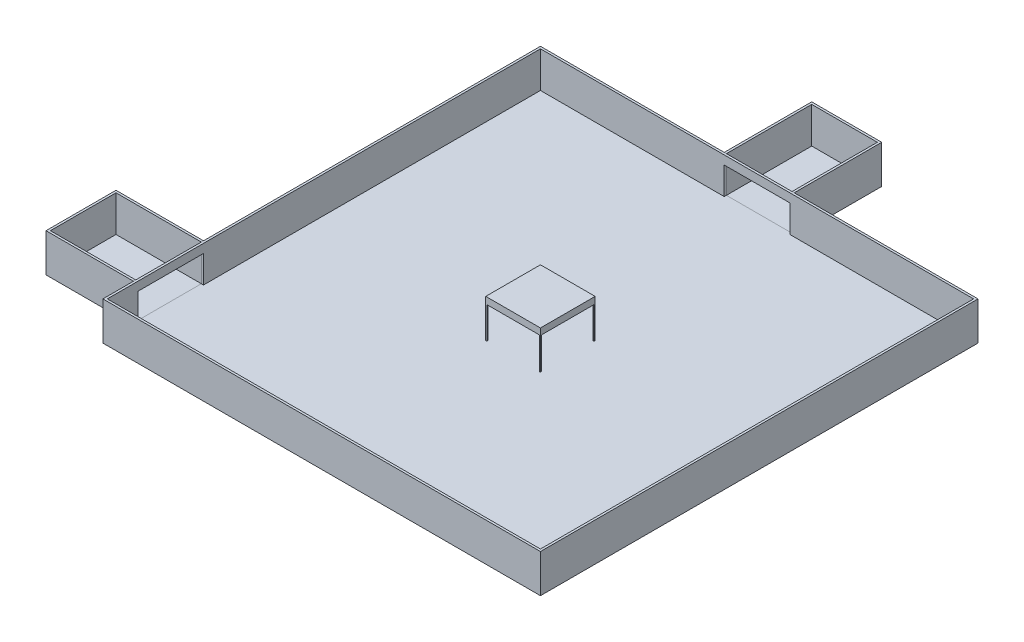
from build123d import *

# Parameters (mm, degrees)
SKETCH_1_W          = 4000
SKETCH_1_H          = 4000
EXTRUDE_1_DEPTH     = 350
SKETCH_2_W          = 3960
SKETCH_2_H          = 3960
CUT_EXTRUDE_1_DEPTH = 330
SKETCH_3_W          = 600
SKETCH_3_H          = 250
CUT_EXTRUDE_2_DEPTH = 20
SKETCH_5_W          = 600
SKETCH_5_H          = 250
CUT_EXTRUDE_3_DEPTH = 20
SKETCH_6_W          = 500
SKETCH_6_H          = 500
EXTRUDE_2_DEPTH     = 350
SKETCH_8_W          = 480
SKETCH_8_H          = 290
CUT_EXTRUDE_4_DEPTH = 500
SKETCH_11_W         = 480
SKETCH_11_H         = 290
CUT_EXTRUDE_5_DEPTH = 500
SKETCH_19_W         = 640
SKETCH_19_H         = 800
EXTRUDE_10_DEPTH    = 350
SKETCH_19_W_2       = 800
SKETCH_19_H_2       = 640
EXTRUDE_10_2_DEPTH  = 350
SKETCH_20_W         = 600
SKETCH_20_H         = 780
SKETCH_20_W_2       = 780
SKETCH_20_H_2       = 600
CUT_EXTRUDE_7_DEPTH = 330


with BuildPart() as part:
    # 草图1 → 凸台-拉伸1 (new body)
    with BuildSketch(Plane(origin=(0, 0, 0), x_dir=(1, 0, 0), z_dir=(0, 1, 0))):
        with Locations((2000, 2000)):
            Rectangle(SKETCH_1_W, SKETCH_1_H)
    extrude(amount=EXTRUDE_1_DEPTH)

    # 草图2 → 切除-拉伸1 (cut)
    with BuildSketch(Plane(origin=(0, 350, 0), x_dir=(1, 0, 0), z_dir=(0, 1, 0))):
        with Locations((2000, 2000)):
            Rectangle(SKETCH_2_W, SKETCH_2_H)
    extrude(amount=-CUT_EXTRUDE_1_DEPTH, mode=Mode.SUBTRACT)

    # 草图3 → 切除-拉伸2 (cut)
    with BuildSketch(Plane(origin=(0, 0, -4000), x_dir=(-1, 0, 0), z_dir=(0, 0, -1))):
        with Locations((-2000, 145)):
            Rectangle(SKETCH_3_W, SKETCH_3_H)
    extrude(amount=-CUT_EXTRUDE_2_DEPTH, mode=Mode.SUBTRACT)

    # 草图5 → 切除-拉伸3 (cut)
    with BuildSketch(Plane.ZY):
        with Locations((-600, 145)):
            Rectangle(SKETCH_5_W, SKETCH_5_H)
    extrude(amount=-CUT_EXTRUDE_3_DEPTH, mode=Mode.SUBTRACT)

    # 草图6 → 凸台-拉伸2 (add)
    with BuildSketch(Plane(origin=(0, 20, 0), x_dir=(1, 0, 0), z_dir=(0, 1, 0))):
        with Locations((2000, 2000)):
            Rectangle(SKETCH_6_W, SKETCH_6_H)
    extrude(amount=EXTRUDE_2_DEPTH)

    # 草图8 → 切除-拉伸4 (cut)
    with BuildSketch(Plane.XY.offset(-1750)):
        with Locations((2000, 165)):
            Rectangle(SKETCH_8_W, SKETCH_8_H)
    extrude(amount=-CUT_EXTRUDE_4_DEPTH, mode=Mode.SUBTRACT)

    # 草图11 → 切除-拉伸5 (cut)
    with BuildSketch(Plane.ZY.offset(-1750)):
        with Locations((-2000, 165)):
            Rectangle(SKETCH_11_W, SKETCH_11_H)
    extrude(amount=-CUT_EXTRUDE_5_DEPTH, mode=Mode.SUBTRACT)


with BuildPart() as body_2:
    # 草图19 → 凸台-拉伸10 (new body)
    with BuildSketch(Plane.XZ):
        with Locations((2000, -4400)):
            Rectangle(SKETCH_19_W, SKETCH_19_H)
    extrude(amount=-EXTRUDE_10_DEPTH)


with BuildPart() as body_3:
    # 草图19 → Extrude 10 2 (new body)
    with BuildSketch(Plane.XZ):
        with Locations((-400, -600)):
            Rectangle(SKETCH_19_W_2, SKETCH_19_H_2)
    extrude(amount=-EXTRUDE_10_2_DEPTH)


with BuildPart() as cut_extrude_7_tool:
    # 草图20 → 切除-拉伸7 (new body)
    with BuildSketch(Plane(origin=(0, 350, 0), x_dir=(1, 0, 0), z_dir=(0, 1, 0))):
        with Locations((2000, 4390)):
            Rectangle(SKETCH_20_W, SKETCH_20_H)
        with Locations((-390, 600)):
            Rectangle(SKETCH_20_W_2, SKETCH_20_H_2)
    extrude(amount=-CUT_EXTRUDE_7_DEPTH)


with BuildPart() as body_2_1:
    add(body_2.part)

    # 切除-拉伸7: cut by cut_extrude_7_tool
    add(cut_extrude_7_tool.part, mode=Mode.SUBTRACT)


with BuildPart() as body_3_1:
    add(body_3.part)

    # 切除-拉伸7: cut by cut_extrude_7_tool
    add(cut_extrude_7_tool.part, mode=Mode.SUBTRACT)


solid = Compound([part.part, body_2_1.part, body_3_1.part])
